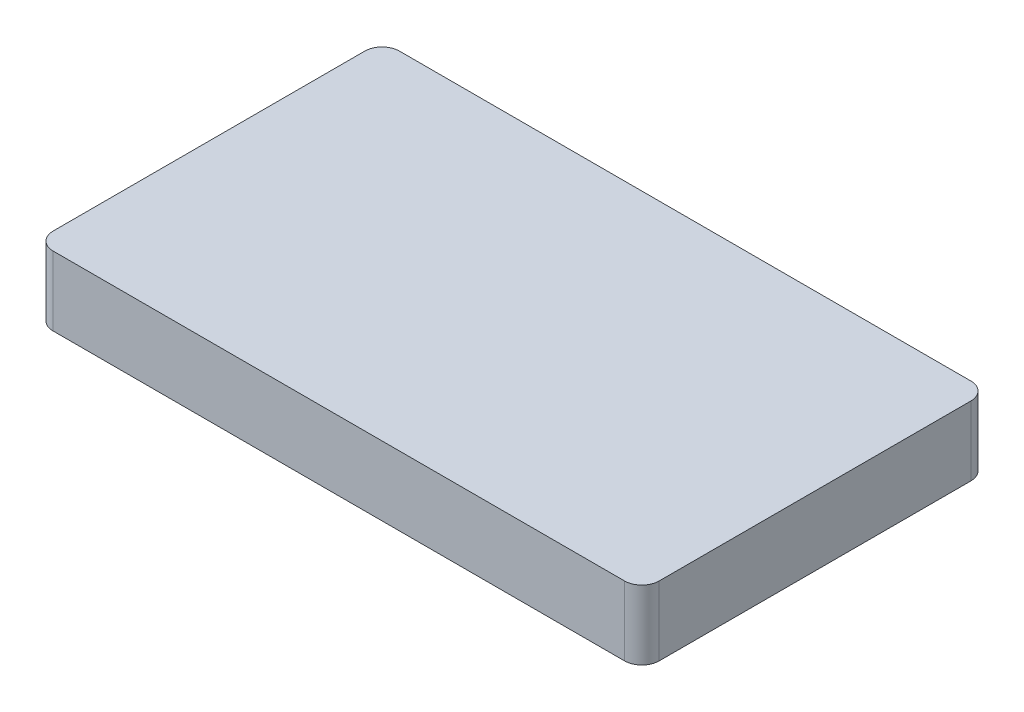
from build123d import *

# Parameters (mm, degrees)
SKETCH1_W           = 22.225
SKETCH1_H           = 12.7
BOSS_EXTRUDE1_DEPTH = 2.54
FILLET1_R           = 0.635
SHELL1_START        = 0.635
SHELL1_OUTLINE_W    = 1.905
SHELL1_OUTLINE_H    = 11.43
SHELL1_DEPTH        = 20.955
SKETCH2_R           = 2.54
BOSS_EXTRUDE2_DEPTH = 1.905


# Read off the part's stored shape, not the designer's step: Shell1
with BuildPart() as part:
    # Sketch1 → Boss-Extrude1 (new body)
    with BuildSketch(Plane(origin=(0, 0, 0), x_dir=(1, 0, 0), z_dir=(0, 1, 0))):
        with Locations((11.1125, 6.35)):
            Rectangle(SKETCH1_W, SKETCH1_H)
    extrude(amount=BOSS_EXTRUDE1_DEPTH)

    # Fillet1
    fillet1_edges = [part.edges().sort_by_distance(p)[0] for p in [
        (0, 1.27, -12.7),
        (22.225, 1.27, -12.7),
        (22.225, 1.27, 0),
        (0, 1.27, 0),
    ]]
    fillet(fillet1_edges, radius=FILLET1_R)

    # Shell1 outline → Shell1 (cut)
    with BuildSketch(Plane.YZ.offset(SHELL1_START)):
        with Locations((0.9525, -6.35)):
            Rectangle(SHELL1_OUTLINE_W, SHELL1_OUTLINE_H)
    extrude(amount=SHELL1_DEPTH, mode=Mode.SUBTRACT)

    # Sketch2 → Boss-Extrude2 (add)
    with BuildSketch(Plane(origin=(0, 1.905, 0), x_dir=(-1, 0, 0), z_dir=(0, -1, 0))):
        with Locations(Location((-11.1125, 6.35, 0), (0, 0, 270))):
            Circle(SKETCH2_R)
    extrude(amount=BOSS_EXTRUDE2_DEPTH)


solid = part.part
